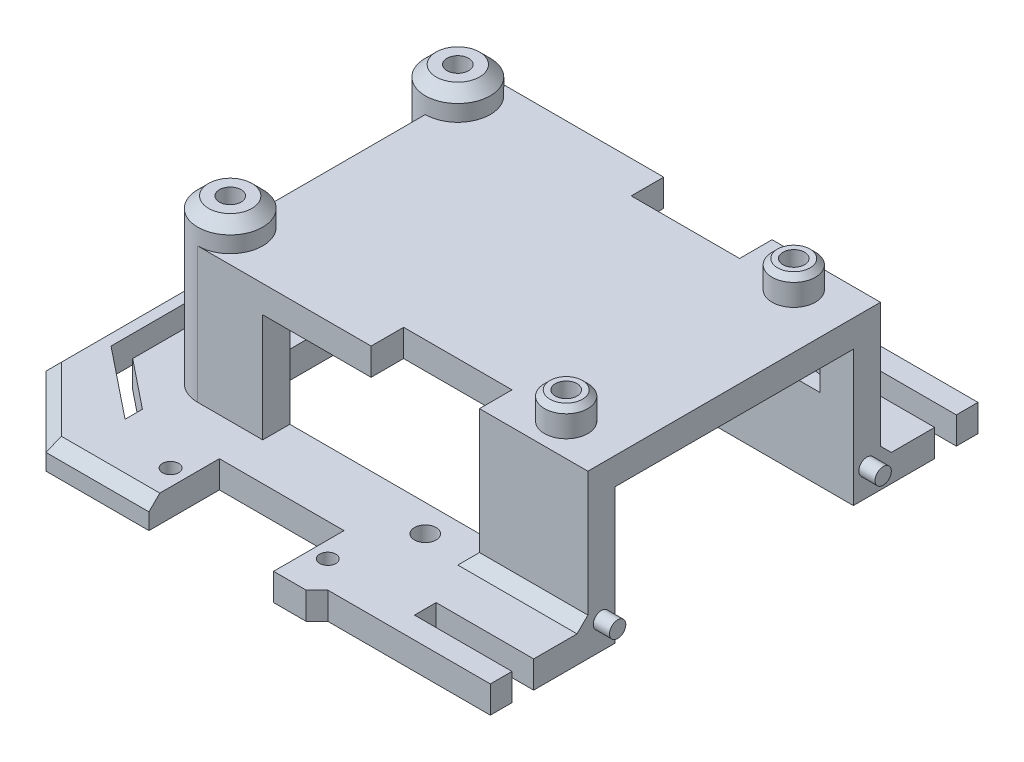
from build123d import *

# Parameters (mm, degrees)
SKETCH1_R           = 2
SKETCH1_R_2         = 1.5
BOSS_EXTRUDE1_DEPTH = 5
SKETCH2_W           = 4
SKETCH2_H           = 16
CUT_EXTRUDE1_DEPTH  = 5
BOSS_EXTRUDE3_DEPTH = 25
SKETCH4_W           = 72
SKETCH4_H           = 54
BOSS_EXTRUDE4_DEPTH = 5
SKETCH5_W           = 40
SKETCH5_H           = 20
CUT_EXTRUDE2_DEPTH  = 123.576506721
SKETCH6_W           = 20
SKETCH6_H           = 6
CUT_EXTRUDE4_DEPTH  = 10
BOSS_EXTRUDE5_START = -5
SKETCH7_R           = 4
BOSS_EXTRUDE5_DEPTH = 5
SKETCH8_R           = 2
CUT_EXTRUDE5_DEPTH  = 10
CUT_EXTRUDE6_START  = 10
SKETCH9_R           = 4
CUT_EXTRUDE6_DEPTH  = 10
BOSS_EXTRUDE6_START = 5
SKETCH10_R          = 6
BOSS_EXTRUDE6_DEPTH = 30
SKETCH11_R          = 2
CUT_EXTRUDE7_DEPTH  = 10
CUT_EXTRUDE8_START  = 20
SKETCH12_R          = 4.5
CUT_EXTRUDE8_DEPTH  = 129.434311913
SKETCH14_R          = 4.5
CUT_EXTRUDE11_DEPTH = 108.158760724
SKETCH13_R          = 1.5
BOSS_EXTRUDE8_DEPTH = 3
CHAMFER2_SIZE       = 1
CHAMFER3_SIZE       = 2
CHAMFER4_SIZE       = 2
CHAMFER5_SIZE       = 2


with BuildPart() as part:
    # Sketch1 → Boss-Extrude1 (new body)
    with BuildSketch(Plane(origin=(0, 0, 0), x_dir=(1, 0, 0), z_dir=(0, 1, 0))):
        Polygon((0, 34), (0, -34), (13, -47), (32, -47), (32, -34), (55, -34), (55, -47), (61, -47), (63, -45), (93, -45), (93, -41), (75, -41), (75, -37), (93, -37), (93, -22), (33, -22), (21, -10), (21, 10), (33, 22), (93, 22), (93, 37), (75, 37), (75, 41), (93, 41), (93, 45), (63, 45), (61, 47), (55, 47), (55, 34), (32, 34), (32, 47), (13, 47), align=None)
        with Locations(Location((13, -10, 0), (0, 0, 270))):
            Circle(SKETCH1_R, mode=Mode.SUBTRACT)
        with Locations(Location((29, -40, 0), (0, 0, 270))):
            Circle(SKETCH1_R_2, mode=Mode.SUBTRACT)
        with Locations(Location((58, -40, 0), (0, 0, 270))):
            Circle(SKETCH1_R_2, mode=Mode.SUBTRACT)
        with Locations(Location((63, -27, 0), (0, 0, 270))):
            Circle(SKETCH1_R, mode=Mode.SUBTRACT)
        with Locations(Location((13, 10, 0), (0, 0, 90))):
            Circle(SKETCH1_R, mode=Mode.SUBTRACT)
        with Locations(Location((29, 40, 0), (0, 0, 90))):
            Circle(SKETCH1_R_2, mode=Mode.SUBTRACT)
        with Locations(Location((58, 40, 0), (0, 0, 90))):
            Circle(SKETCH1_R_2, mode=Mode.SUBTRACT)
        with Locations(Location((63, 27, 0), (0, 0, 90))):
            Circle(SKETCH1_R, mode=Mode.SUBTRACT)
    extrude(amount=BOSS_EXTRUDE1_DEPTH)

    # Sketch2 → Cut-Extrude1 (cut)
    with BuildSketch(Plane(origin=(0, 5, 0), x_dir=(1, 0, 0), z_dir=(0, 1, 0))):
        Polygon((17, 33.205766921), (17, 36.408329997), (4, 26), (4, 12), (8, 12), (8, 26), align=None)
        with Locations((6, 0)):
            Rectangle(SKETCH2_W, SKETCH2_H)
        Polygon((17, -33.205766921), (17, -36.408329997), (4, -26), (4, -12), (8, -12), (8, -26), align=None)
    extrude(amount=-CUT_EXTRUDE1_DEPTH, mode=Mode.SUBTRACT)

    # Sketch3 → Boss-Extrude3 (add)
    with BuildSketch(Plane(origin=(0, 5, 0), x_dir=(1, 0, 0), z_dir=(0, 1, 0))):
        Polygon((21, 27), (21, 10), (33, 22), (93, 22), (93, 27), align=None)
        Polygon((93, -27), (93, -22), (33, -22), (21, -10), (21, -27), align=None)
    extrude(amount=BOSS_EXTRUDE3_DEPTH)

    # Sketch4 → Boss-Extrude4 (add)
    with BuildSketch(Plane(origin=(0, 30, 0), x_dir=(1, 0, 0), z_dir=(0, 1, 0))):
        with Locations((57, 0)):
            Rectangle(SKETCH4_W, SKETCH4_H)
    extrude(amount=-BOSS_EXTRUDE4_DEPTH)

    # Sketch5 → Cut-Extrude2 (cut, through all)
    with BuildSketch(Plane.XY.offset(27)):
        with Locations((53, 15)):
            Rectangle(SKETCH5_W, SKETCH5_H)
    extrude(amount=-CUT_EXTRUDE2_DEPTH, mode=Mode.SUBTRACT)

    # Sketch6 → Cut-Extrude4 (cut)
    with BuildSketch(Plane(origin=(0, 30, 0), x_dir=(1, 0, 0), z_dir=(0, 1, 0))):
        with Locations((63, 24)):
            Rectangle(SKETCH6_W, SKETCH6_H)
        with Locations((63, -24)):
            Rectangle(SKETCH6_W, SKETCH6_H)
    extrude(amount=-CUT_EXTRUDE4_DEPTH, mode=Mode.SUBTRACT)

    # Sketch7 → Boss-Extrude5 (add)
    with BuildSketch(Plane.XZ.offset(-25).offset(BOSS_EXTRUDE5_START)):
        with Locations(Location((83, 21, 0), (0, 0, 270))):
            Circle(SKETCH7_R)
        with Locations(Location((83, -21, 0), (0, 0, 270))):
            Circle(SKETCH7_R)
    extrude(amount=-BOSS_EXTRUDE5_DEPTH)

    # Sketch8 → Cut-Extrude5 (cut)
    with BuildSketch(Plane(origin=(0, 35, 0), x_dir=(1, 0, 0), z_dir=(0, 1, 0))):
        with Locations(Location((83, 21, 0), (0, 0, 270))):
            Circle(SKETCH8_R)
    cut_extrude5 = extrude(amount=-CUT_EXTRUDE5_DEPTH, mode=Mode.SUBTRACT)

    # Sketch9 → Cut-Extrude6 (cut)
    with BuildSketch(Plane.XZ.offset(-25).offset(CUT_EXTRUDE6_START)):
        with Locations(Location((83, -21, 0), (0, 0, 270))):
            Circle(SKETCH9_R)
    cut_extrude6 = extrude(amount=-CUT_EXTRUDE6_DEPTH, mode=Mode.SUBTRACT)

    # Sketch10 → Boss-Extrude6 (add)
    with BuildSketch(Plane(origin=(0, 30, 0), x_dir=(1, 0, 0), z_dir=(0, 1, 0)).offset(BOSS_EXTRUDE6_START)):
        with Locations(Location((21, 21, 0), (0, 0, 270))):
            Circle(SKETCH10_R)
    boss_extrude6 = extrude(amount=-BOSS_EXTRUDE6_DEPTH)

    # Sketch11 → Cut-Extrude7 (cut)
    with BuildSketch(Plane(origin=(0, 35, 0), x_dir=(1, 0, 0), z_dir=(0, 1, 0))):
        with Locations(Location((21, 21, 0), (0, 0, 270))):
            Circle(SKETCH11_R)
    cut_extrude7 = extrude(amount=-CUT_EXTRUDE7_DEPTH, mode=Mode.SUBTRACT)

    # Sketch12 → Cut-Extrude8 (cut, through all)
    with BuildSketch(Plane(origin=(0, 5, 0), x_dir=(1, 0, 0), z_dir=(0, 1, 0)).offset(CUT_EXTRUDE8_START)):
        with Locations(Location((21, 21, 0), (0, 0, 270))):
            Circle(SKETCH12_R)
    extrude(amount=-CUT_EXTRUDE8_DEPTH, mode=Mode.SUBTRACT)

    # Mirror11: Cut-Extrude5, Cut-Extrude6 across plane
    add(cut_extrude5.mirror(Plane.XY), mode=Mode.SUBTRACT)
    add(cut_extrude6.mirror(Plane.XY), mode=Mode.SUBTRACT)

    # Mirror12: Boss-Extrude6 across plane
    add(boss_extrude6.mirror(Plane.XY))

    # Mirror16: Cut-Extrude7 across plane
    add(cut_extrude7.mirror(Plane.XY), mode=Mode.SUBTRACT)

    # Sketch14 → Cut-Extrude11 (cut, through all)
    with BuildSketch(Plane(origin=(0, 25, 0), x_dir=(1, 0, 0), z_dir=(0, 1, 0))):
        with Locations(Location((21, -21, 0), (0, 0, 270))):
            Circle(SKETCH14_R)
    extrude(amount=-CUT_EXTRUDE11_DEPTH, mode=Mode.SUBTRACT)

    # Sketch13 → Boss-Extrude8 (add)
    with BuildSketch(Plane(origin=(93, 0, 0), x_dir=(0, 0, -1), z_dir=(1, 0, 0))):
        with Locations(Location((24.5, 5, 0), (0, 0, 180))):
            Circle(SKETCH13_R)
    boss_extrude8 = extrude(amount=BOSS_EXTRUDE8_DEPTH)

    # Mirror19: Boss-Extrude8 across plane
    add(boss_extrude8.mirror(Plane.XY))

    # Chamfer2
    chamfer2_edges = [part.edges().sort_by_distance(p)[0] for p in [
        (83, 35, 25),
        (83, 35, -17),
    ]]
    chamfer(chamfer2_edges, length=CHAMFER2_SIZE)

    # Chamfer3
    chamfer3_edges = [part.edges().sort_by_distance(p)[0] for p in [
        (22.5, 5, -47),
        (6.5, 5, -40.5),
        (0, 5, 0),
        (6.5, 5, 40.5),
        (21, 35, -27),
        (21, 35, 27),
        (22.5, 5, 47),
    ]]
    chamfer(chamfer3_edges, length=CHAMFER3_SIZE)

    # Chamfer4
    chamfer4_edges = [part.edges().sort_by_distance(p)[0] for p in [
        (83, 5, -27),
        (83, 5, 27),
        (73, 5, 24.5),
        (73, 5, -24.5),
    ]]
    chamfer(chamfer4_edges, length=CHAMFER4_SIZE)

    # Chamfer5
    chamfer5_edges = [part.edges().sort_by_distance(p)[0] for p in [
        (83, 25, -23),
        (83, 25, 23),
    ]]
    chamfer(chamfer5_edges, length=CHAMFER5_SIZE - 0.0001)  # a hair under: the kernel refuses the full size


solid = part.part
